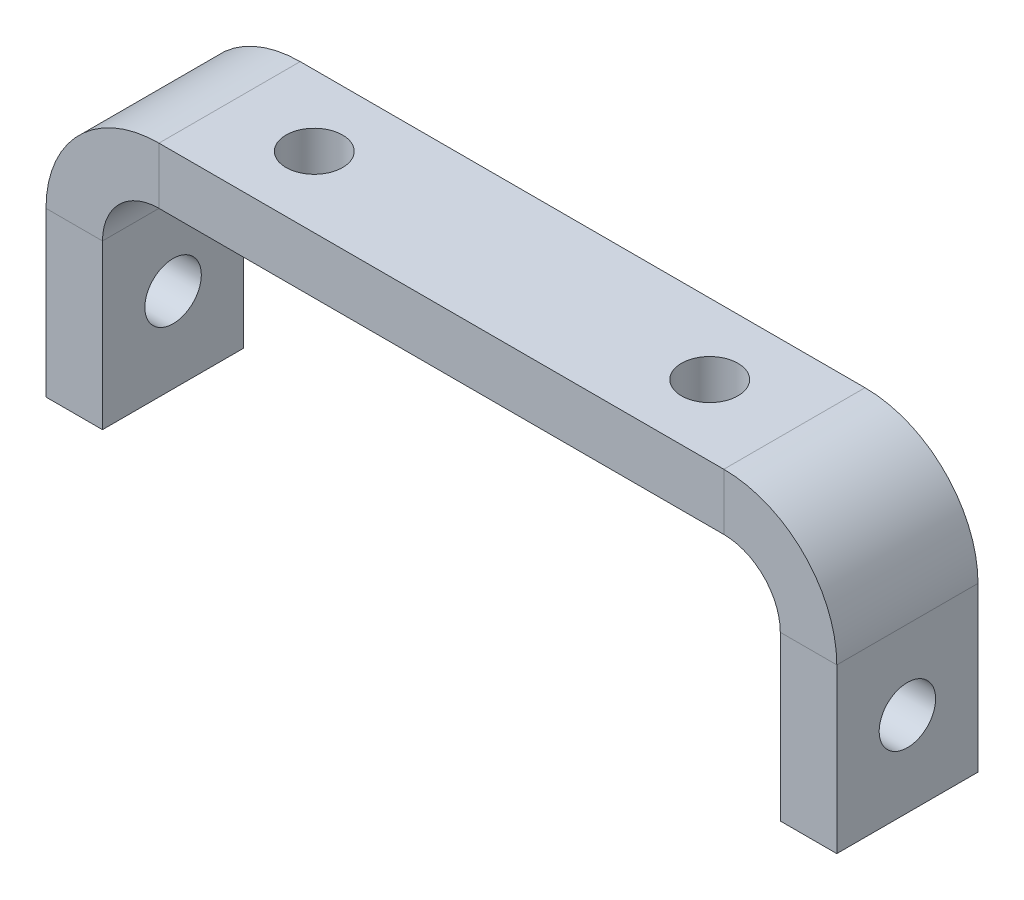
from build123d import *

# Parameters (mm, degrees)
SKETCH1_W                  = 82
SKETCH1_H                  = 10
SKETCH1_R                  = 2
BASE_FLANGE1_DEPTH         = 4
SKETCHED_START             = -5
SKETCHED_BEND1_DEPTH       = 10
SKETCHED_BEND1_2_DEPTH     = 2.9999999
SKETCHED_START_2           = 2.0000001
SKETCHED_BEND1_3_DEPTH     = 2.9999999
SKETCHED_START_3           = -2.0000001
SKETCHED_BEND1_4_DEPTH     = 4.0000002
SKETCHED_START_4           = -28
SKETCHED_BEND1_5_OUTLINE_R = 2
SKETCHED_BEND1_5_DEPTH     = 56


with BuildPart() as part:
    # Base-Flange1: sheet metal written as solids
    # Sketch1 → Base-Flange1 (new body)
    with BuildSketch(Plane(origin=(0, 0, 0), x_dir=(1, 0, 0), z_dir=(0, 1, 0))):
        Rectangle(SKETCH1_W, SKETCH1_H)
        with Locations(Location((14, 0, 0), (0, 0, 270))):
            Circle(SKETCH1_R, mode=Mode.SUBTRACT)
        with Locations(Location((35, 0, 0), (0, 0, 270))):
            Circle(SKETCH1_R, mode=Mode.SUBTRACT)
        with Locations(Location((-35, 0, 0), (0, 0, 90))):
            Circle(SKETCH1_R, mode=Mode.SUBTRACT)
        with Locations(Location((-14, 0, 0), (0, 0, 90))):
            Circle(SKETCH1_R, mode=Mode.SUBTRACT)
    extrude(amount=-BASE_FLANGE1_DEPTH)

    # Sketched Bend1: read off the stored shape, not the designer's step
    # Sketched Bend1 outline → Sketched Bend1 (cut)
    with BuildSketch(Plane.XY.offset(SKETCHED_START)):
        with BuildLine():
            ThreePointArc((20, 0), (23.999999999, -1.07179677), (26.92820323, -4))
            Line((26.92820323, -4), (41, -4))
            Line((41, -4), (41, 0))
            Line((41, 0), (20, 0))
        make_face()
        with BuildLine():
            Line((-41, -4), (-26.92820323, -4))
            ThreePointArc((-26.92820323, -4), (-23.999999999, -1.07179677), (-20, 0))
            Line((-20, 0), (-41, 0))
            Line((-41, 0), (-41, -4))
        make_face()
    extrude(amount=SKETCHED_BEND1_DEPTH, mode=Mode.SUBTRACT)

    # Sketched Bend1 2 outline → Sketched Bend1 2 (add)
    with BuildSketch(Plane.XY.offset(SKETCHED_START)):
        with BuildLine():
            ThreePointArc((20, -4), (22.828427125, -5.171572875), (24, -8))
            Line((24, -8), (24, -19.575222039))
            Line((24, -19.575222039), (28, -19.575222039))
            Line((28, -19.575222039), (28, -8))
            ThreePointArc((28, -8), (27.72740661, -5.929447639), (26.92820323, -4))
            Line((26.92820323, -4), (20, -4))
        make_face()
        with BuildLine():
            ThreePointArc((-24, -8), (-22.828427125, -5.171572875), (-20, -4))
            Line((-20, -4), (-26.92820323, -4))
            ThreePointArc((-26.92820323, -4), (-27.72740661, -5.929447639), (-28, -8))
            Line((-28, -8), (-28, -19.575222039))
            Line((-28, -19.575222039), (-24, -19.575222039))
            Line((-24, -19.575222039), (-24, -8))
        make_face()
    extrude(amount=SKETCHED_BEND1_2_DEPTH)

    # Sketched Bend1 3 outline → Sketched Bend1 3 (add)
    with BuildSketch(Plane.XY.offset(SKETCHED_START_2)):
        with BuildLine():
            ThreePointArc((20, -4), (22.828427125, -5.171572875), (24, -8))
            Line((24, -8), (24, -19.575222039))
            Line((24, -19.575222039), (28, -19.575222039))
            Line((28, -19.575222039), (28, -8))
            ThreePointArc((28, -8), (27.72740661, -5.929447639), (26.92820323, -4))
            Line((26.92820323, -4), (20, -4))
        make_face()
        with BuildLine():
            ThreePointArc((-24, -8), (-22.828427125, -5.171572875), (-20, -4))
            Line((-20, -4), (-26.92820323, -4))
            ThreePointArc((-26.92820323, -4), (-27.72740661, -5.929447639), (-28, -8))
            Line((-28, -8), (-28, -19.575222039))
            Line((-28, -19.575222039), (-24, -19.575222039))
            Line((-24, -19.575222039), (-24, -8))
        make_face()
    extrude(amount=SKETCHED_BEND1_3_DEPTH)

    # Sketched Bend1 4 outline → Sketched Bend1 4 (add)
    with BuildSketch(Plane.XY.offset(SKETCHED_START_3)):
        with BuildLine():
            ThreePointArc((-24, -8), (-22.828427125, -5.171572875), (-20, -4))
            Line((-20, -4), (-26.92820323, -4))
            ThreePointArc((-26.92820323, -4), (-27.72740661, -5.929447639), (-28, -8))
            Line((-28, -8), (-28, -19.575222039))
            Line((-28, -19.575222039), (-24, -19.575222039))
            Line((-24, -19.575222039), (-24, -8))
        make_face()
        with BuildLine():
            ThreePointArc((20, -4), (22.828427125, -5.171572875), (24, -8))
            Line((24, -8), (24, -19.575222039))
            Line((24, -19.575222039), (28, -19.575222039))
            Line((28, -19.575222039), (28, -8))
            ThreePointArc((28, -8), (27.72740661, -5.929447639), (26.92820323, -4))
            Line((26.92820323, -4), (20, -4))
        make_face()
    extrude(amount=SKETCHED_BEND1_4_DEPTH)

    # Sketched Bend1 5 outline → Sketched Bend1 5 (cut)
    with BuildSketch(Plane.YZ.offset(SKETCHED_START_4)):
        with Locations((-13.575222039, 0)):
            Circle(SKETCHED_BEND1_5_OUTLINE_R)
    extrude(amount=SKETCHED_BEND1_5_DEPTH, mode=Mode.SUBTRACT)


solid = part.part
